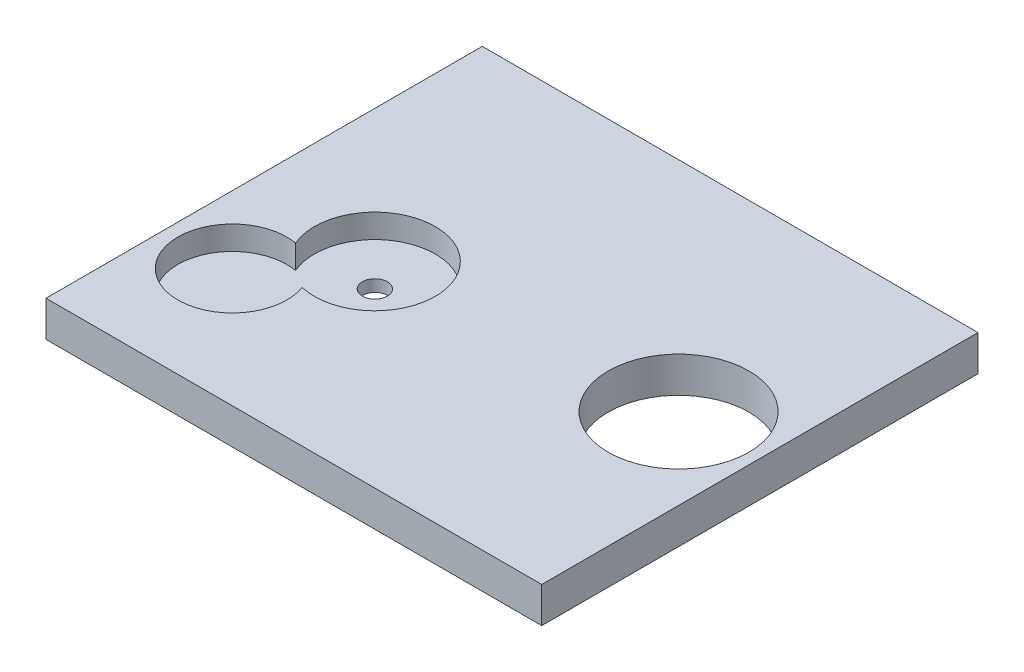
from build123d import *

# Parameters (mm, degrees)
SKETCH1_W               = 125
SKETCH1_H               = 110
TOP_BASE_DEPTH          = 9
GEARS_EXTRUDE_CUT_DEPTH = 6
SKETCH7_R               = 3.15
KEY_EXTRUDE_CUT_DEPTH   = 167.751311839
SKETCH8_R               = 17.75
CUT_EXTRUDE3_DEPTH      = 167.751311839


with BuildPart() as part:
    # Sketch1 → Top_Base (new body)
    with BuildSketch(Plane(origin=(0, 0, 0), x_dir=(1, 0, 0), z_dir=(0, 1, 0))):
        with Locations((62.5, 55)):
            Rectangle(SKETCH1_W, SKETCH1_H)
    extrude(amount=TOP_BASE_DEPTH)

    # Sketch5 → Gears_Extrude_Cut (cut)
    with BuildSketch(Plane(origin=(0, 9, 0), x_dir=(1, 0, 0), z_dir=(0, 1, 0))):
        with BuildLine():
            ThreePointArc((29.937781906, 34.640615096), (43.258076477, 61.146924881), (19.394433085, 43.524744825))
            ThreePointArc((19.394433085, 43.524744825), (8.139912845, 19.470017809), (29.937781906, 34.640615096))
        make_face()
    extrude(amount=-GEARS_EXTRUDE_CUT_DEPTH, mode=Mode.SUBTRACT)

    # Sketch7 → Key_Extrude_Cut (cut, through all)
    with BuildSketch(Plane(origin=(0, 9, 0), x_dir=(1, 0, 0), z_dir=(0, 1, 0))):
        with Locations((33.43143436, 49.48503804)):
            Circle(SKETCH7_R)
    extrude(amount=-KEY_EXTRUDE_CUT_DEPTH, mode=Mode.SUBTRACT)

    # Sketch8 → Cut-Extrude3 (cut, through all)
    with BuildSketch(Plane(origin=(0, 9, 0), x_dir=(1, 0, 0), z_dir=(0, 1, 0))):
        with Locations((104.5, 55)):
            Circle(SKETCH8_R)
    extrude(amount=-CUT_EXTRUDE3_DEPTH, mode=Mode.SUBTRACT)


solid = part.part
